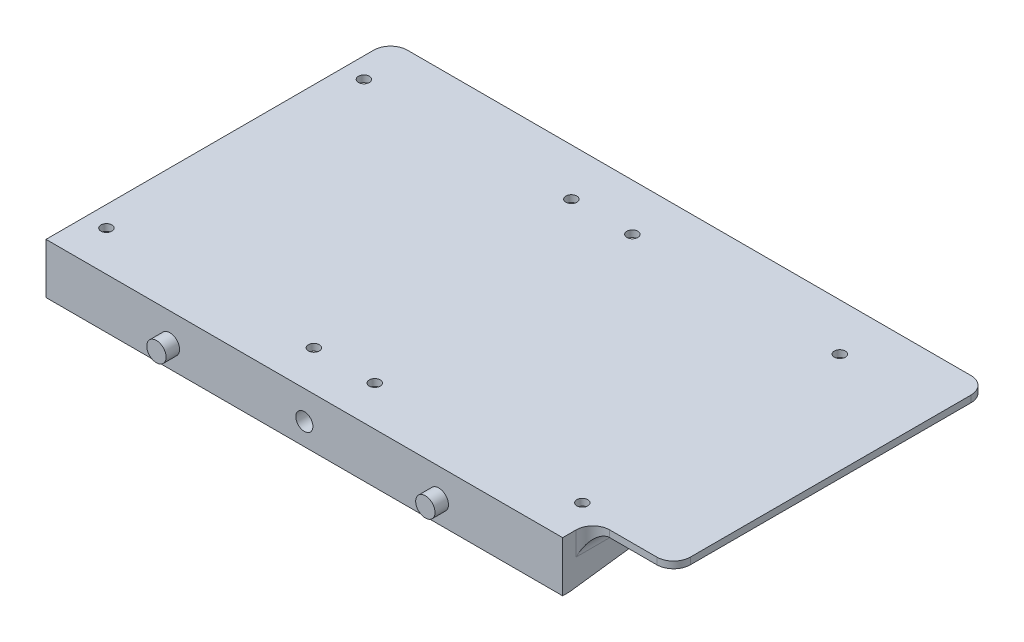
from build123d import *

# Parameters (mm, degrees)
SKETCH1_W           = 10
SKETCH1_H           = 100.5
SKETCH1_R           = 1.625
SKETCH1_W_2         = 69.85
BOSS_EXTRUDE1_DEPTH = 2
SKETCH3_W           = 149.7
SKETCH3_H           = 2
BOSS_EXTRUDE2_DEPTH = 2
SKETCH4_W           = 100.5
SKETCH4_H           = 2
BOSS_EXTRUDE3_DEPTH = 2
BOSS_EXTRUDE4_DEPTH = 2
SKETCH6_W           = 8
SKETCH6_H           = 15
BOSS_EXTRUDE5_DEPTH = 3
CUT_EXTRUDE1_DEPTH  = 10
FILLET1_R           = 3
CUT_EXTRUDE2_DEPTH  = 10
BOSS_EXTRUDE6_START = 3
SKETCH10_R          = 4
SKETCH10_R_2        = 2.55
BOSS_EXTRUDE6_DEPTH = 3
SKETCH12_R          = 2.875
BOSS_EXTRUDE7_DEPTH = 4
SKETCH13_W          = 10.946886228
SKETCH13_H          = 17.580383234
SKETCH13_W_2        = 10.296538922
SKETCH13_H_2        = 23.433508982
CUT_EXTRUDE3_DEPTH  = 43
SKETCH15_W          = 24
SKETCH15_H          = 93.5
BOSS_EXTRUDE8_DEPTH = 2
FILLET2_R           = 5
FILLET3_R           = 5


with BuildPart() as part:
    # Sketch1 → Boss-Extrude1 (new body)
    # profile 1 of 3: a face of its own
    with BuildSketch(Plane(origin=(0, 0, 0), x_dir=(1, 0, 0), z_dir=(0, 1, 0))):
        with Locations((74.85, 50.25)):
            Rectangle(SKETCH1_W, SKETCH1_H)
    # profile 2 of 3: a face of its own
    with BuildSketch(Plane(origin=(0, 0, 0), x_dir=(1, 0, 0), z_dir=(0, 1, 0))):
        Polygon((0, 0), (69.85, 0), (69.85, 100.5), (0, 100.5), (0, 86.5), align=None)
        with Locations(Location((4.07, 9.9, 0), (0, 0, 270))):
            Circle(SKETCH1_R, mode=Mode.SUBTRACT)
        with BuildLine():
            ThreePointArc((64.165, 9.9), (64.640951481, 11.049048519), (65.79, 11.525))
            ThreePointArc((65.79, 11.525), (66.939048519, 11.049048519), (67.415, 9.9))
            ThreePointArc((67.415, 9.9), (65.79, 8.275), (64.165, 9.9))
        make_face(mode=Mode.SUBTRACT)
        with BuildLine():
            ThreePointArc((5.695, 86.5), (4.07, 84.875), (2.445, 86.5))
            ThreePointArc((2.445, 86.5), (4.07, 88.125), (5.695, 86.5))
        make_face(mode=Mode.SUBTRACT)
        with BuildLine():
            ThreePointArc((65.79, 84.875), (64.640951481, 85.350951481), (64.165, 86.5))
            ThreePointArc((64.165, 86.5), (65.79, 88.125), (67.415, 86.5))
            ThreePointArc((67.415, 86.5), (66.939048519, 85.350951481), (65.79, 84.875))
        make_face(mode=Mode.SUBTRACT)
    # profile 3 of 3: a face of its own
    with BuildSketch(Plane(origin=(0, 0, 0), x_dir=(1, 0, 0), z_dir=(0, 1, 0))):
        with Locations((114.775, 50.25)):
            Rectangle(SKETCH1_W_2, SKETCH1_H)
        with Locations(Location((83.92, 9.9, 0), (0, 0, 270))):
            Circle(SKETCH1_R, mode=Mode.SUBTRACT)
        with Locations(Location((145.64, 9.9, 0), (0, 0, 270))):
            Circle(SKETCH1_R, mode=Mode.SUBTRACT)
        with Locations(Location((83.92, 86.5, 0), (0, 0, 270))):
            Circle(SKETCH1_R, mode=Mode.SUBTRACT)
        with Locations(Location((145.64, 86.5, 0), (0, 0, 270))):
            Circle(SKETCH1_R, mode=Mode.SUBTRACT)
    extrude(amount=BOSS_EXTRUDE1_DEPTH)

    # Sketch3 → Boss-Extrude2 (add)
    with BuildSketch(Plane.XY):
        Polygon((-10, 2), (-10, -13), (159.7, -13), (159.7, 2), (149.7, 2), (149.7, 0), (0, 0), (0, 2), align=None)
        with Locations((74.85, 1)):
            Rectangle(SKETCH3_W, SKETCH3_H)
    extrude(amount=BOSS_EXTRUDE2_DEPTH)

    # Sketch4 → Boss-Extrude3 (add)
    with BuildSketch(Plane.ZY):
        Polygon((0, 0), (-100.5, 0), (0, -13), align=None)
        with Locations((-50.25, 1)):
            Rectangle(SKETCH4_W, SKETCH4_H)
    extrude(amount=BOSS_EXTRUDE3_DEPTH)

    # Sketch5 → Boss-Extrude4 (add)
    with BuildSketch(Plane(origin=(149.7, 0, 0), x_dir=(0, 0, -1), z_dir=(1, 0, 0))):
        Polygon((100.5, 0), (0, -13), (0, 2), (100.5, 2), align=None)
    extrude(amount=BOSS_EXTRUDE4_DEPTH)

    # Sketch6 → Boss-Extrude5 (add)
    with BuildSketch(Plane(origin=(0, 0, 0), x_dir=(-1, 0, 0), z_dir=(0, 0, -1))):
        with Locations((6, -5.5)):
            Rectangle(SKETCH6_W, SKETCH6_H)
        with Locations((-155.7, -5.5)):
            Rectangle(SKETCH6_W, SKETCH6_H)
    extrude(amount=BOSS_EXTRUDE5_DEPTH)

    # Sketch8 → Cut-Extrude1 (cut)
    with BuildSketch(Plane(origin=(0, 0, -3), x_dir=(-1, 0, 0), z_dir=(0, 0, -1))):
        with BuildLine():
            ThreePointArc((-153.15, -5.5), (-155.7, -2.95), (-158.25, -5.5))
            Line((-158.25, -5.5), (-153.15, -5.5))
        make_face()
        with BuildLine():
            Line((-153.15, -5.5), (-158.25, -5.5))
            ThreePointArc((-158.25, -5.5), (-155.7, -8.05), (-153.15, -5.5))
        make_face()
        with BuildLine():
            ThreePointArc((3.45, -5.5), (6, -8.05), (8.55, -5.5))
            Line((8.55, -5.5), (3.45, -5.5))
        make_face()
        with BuildLine():
            Line((3.45, -5.5), (8.55, -5.5))
            ThreePointArc((8.55, -5.5), (6, -2.95), (3.45, -5.5))
        make_face()
    extrude(amount=-CUT_EXTRUDE1_DEPTH, mode=Mode.SUBTRACT)

    # Fillet1
    fillet1_edges = [part.edges().sort_by_distance(p)[0] for p in [
        (159.7, 2, -0.5),
        (-10, 2, -0.5),
        (-10, -13, -0.5),
        (159.7, -13, -0.5),
    ]]
    fillet(fillet1_edges, radius=FILLET1_R)

    # Sketch9 → Cut-Extrude2 (cut)
    with BuildSketch(Plane(origin=(0, 0, 0), x_dir=(-1, 0, 0), z_dir=(0, 0, -1))):
        with BuildLine():
            ThreePointArc((-72.3, -6.5), (-73.046877708, -4.696877708), (-74.85, -3.95))
            Line((-74.85, -3.95), (-74.85, -9.05))
            ThreePointArc((-74.85, -9.05), (-73.046877708, -8.303122292), (-72.3, -6.5))
        make_face()
        with BuildLine():
            Line((-74.85, -9.05), (-74.85, -3.95))
            ThreePointArc((-74.85, -3.95), (-77.4, -6.5), (-74.85, -9.05))
        make_face()
    extrude(amount=-CUT_EXTRUDE2_DEPTH, mode=Mode.SUBTRACT)

    # Sketch10 → Boss-Extrude6 (add)
    with BuildSketch(Plane(origin=(0, 0, 0), x_dir=(-1, 0, 0), z_dir=(0, 0, -1)).offset(BOSS_EXTRUDE6_START)):
        with Locations(Location((-74.85, -6.5, 0), (0, 0, 180))):
            Circle(SKETCH10_R)
        with Locations((-74.85, -6.5)):
            Circle(SKETCH10_R_2, mode=Mode.SUBTRACT)
    extrude(amount=-BOSS_EXTRUDE6_DEPTH)

    # Sketch12 → Boss-Extrude7 (add)
    with BuildSketch(Plane.XY.offset(2)):
        with Locations((34.85, -6.5)):
            Circle(SKETCH12_R)
        with Locations((114.85, -6.5)):
            Circle(SKETCH12_R)
    extrude(amount=BOSS_EXTRUDE7_DEPTH)

    # Sketch13 → Cut-Extrude3 (cut)
    with BuildSketch(Plane(origin=(0, 0, -3), x_dir=(-1, 0, 0), z_dir=(0, 0, -1))):
        with Locations((-157.173443114, -6.790191617)):
            Rectangle(SKETCH13_W, SKETCH13_H)
        with Locations((7.148269461, -9.716754491)):
            Rectangle(SKETCH13_W_2, SKETCH13_H_2)
    extrude(amount=-CUT_EXTRUDE3_DEPTH, mode=Mode.SUBTRACT)

    # Sketch15 → Boss-Extrude8 (add)
    with BuildSketch(Plane(origin=(0, 2, 0), x_dir=(1, 0, 0), z_dir=(0, 1, 0))):
        with Locations((163.7, 53.75)):
            Rectangle(SKETCH15_W, SKETCH15_H)
    extrude(amount=-BOSS_EXTRUDE8_DEPTH)

    # Fillet2
    # the kernel refuses this fillet: 5 mm, written as the material it adds along each edge
    with BuildSketch(Plane(origin=(151.7, 2, -7), x_dir=(1, 0, 0), z_dir=(0, -1, 0))) as fillet2_piece_1:
        with BuildLine():
            CenterArc((FILLET2_R, FILLET2_R), FILLET2_R, 180, 90)
            Line((0, FILLET2_R), (0, 0))
            Line((0, 0), (FILLET2_R, 0))
        make_face()
    extrude(amount=2)
    # the kernel refuses this fillet: 5 mm, written as the material it takes off along each edge
    with BuildSketch(Plane(origin=(175.7, 14.5, -100.5), x_dir=(-1, 0, 0), z_dir=(0, -1, 0)), Plane(origin=(175.7, 14.5, -7), x_dir=(0, 0, -1), z_dir=(0, -1, 0))) as fillet2_2_piece_1:
        with BuildLine():
            CenterArc((FILLET2_R, -FILLET2_R), FILLET2_R, 90, 90)
            Line((0, -FILLET2_R), (0, 0))
            Line((0, 0), (FILLET2_R, 0))
        make_face()
    extrude(amount=27, mode=Mode.SUBTRACT)
    with BuildSketch(Plane(origin=(-2, 14.5, -100.5), x_dir=(1, 0, 0), z_dir=(0, -1, 0))) as fillet2_2_piece_2:
        with BuildLine():
            CenterArc((FILLET2_R, FILLET2_R), FILLET2_R, 180, 90)
            Line((0, FILLET2_R), (0, 0))
            Line((0, 0), (FILLET2_R, 0))
        make_face()
    extrude(amount=27, mode=Mode.SUBTRACT)

    # Fillet3
    fillet3_edges = [part.edges().sort_by_distance(p)[0] for p in [
        (151.7, 0, -51.25),
    ]]
    fillet(fillet3_edges, radius=FILLET3_R)


solid = part.part
